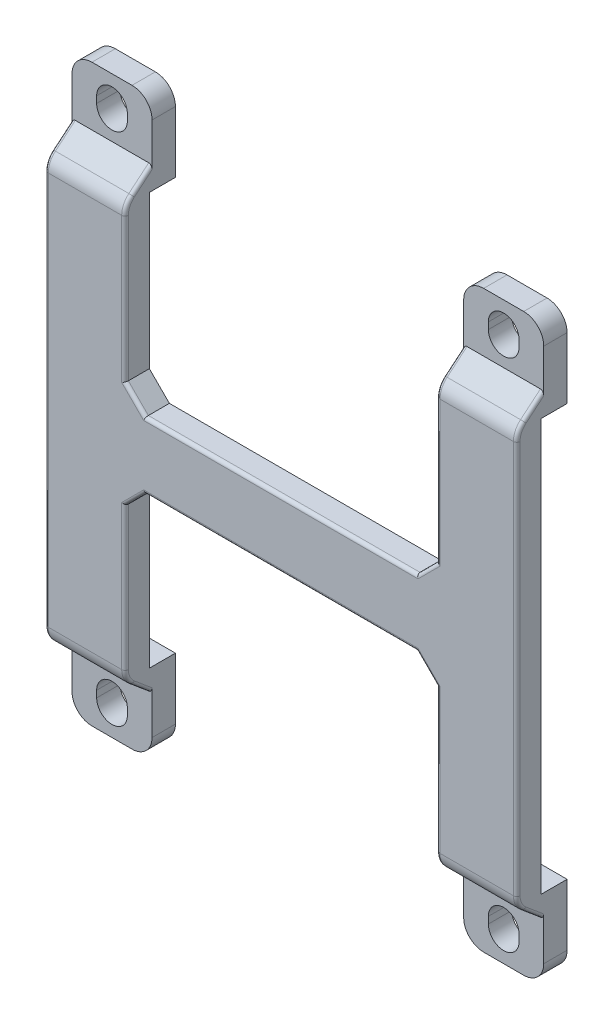
from build123d import *

# Parameters (mm, degrees)
BOSS_EXTRUDE1_DEPTH      = 3
BOSS_EXTRUDE1_DEPTH_BACK = 4.55
CUT_EXTRUDE1_DEPTH       = 3.9
CUT_EXTRUDE2_DEPTH       = 87.014737759
CHAMFER1_SIZE            = 3
FILLET1_R                = 3
FILLET2_R                = 3
FILLET3_R                = 0.5


with BuildPart() as part:
    # Sketch1 → Boss-Extrude1 (new, two sides: drawn at the far end of the back side and taken through both)
    with BuildSketch(Plane.XY.offset(-BOSS_EXTRUDE1_DEPTH_BACK)):
        Polygon((-32.872559152, 37.371494367), (-44.872559152, 37.371494367), (-44.872559152, -48.778505633), (-32.872559152, -48.778505633), (-32.872559152, -10.703505633), (13.827440848, -10.703505633), (13.827440848, -48.778505633), (25.827440848, -48.778505633), (25.827440848, 37.371494367), (13.827440848, 37.371494367), (13.827440848, -0.703505633), (-32.872559152, -0.703505633), align=None)
        with BuildLine():
            ThreePointArc((-36.572559152, 32.371494367), (-38.872559152, 30.071494367), (-41.172559152, 32.371494367))
            Line((-41.172559152, 32.371494367), (-41.172559152, 33.371494367))
            ThreePointArc((-41.172559152, 33.371494367), (-38.872559152, 35.671494367), (-36.572559152, 33.371494367))
            Line((-36.572559152, 33.371494367), (-36.572559152, 32.371494367))
        make_face(mode=Mode.SUBTRACT)
        with BuildLine():
            Line((-36.572559152, -43.778505633), (-36.572559152, -44.778505633))
            ThreePointArc((-36.572559152, -44.778505633), (-38.872559152, -47.078505633), (-41.172559152, -44.778505633))
            Line((-41.172559152, -44.778505633), (-41.172559152, -43.778505633))
            ThreePointArc((-41.172559152, -43.778505633), (-38.872559152, -41.478505633), (-36.572559152, -43.778505633))
        make_face(mode=Mode.SUBTRACT)
        with BuildLine():
            Line((17.527440848, 32.371494367), (17.527440848, 33.371494367))
            ThreePointArc((17.527440848, 33.371494367), (19.827440848, 35.671494367), (22.127440848, 33.371494367))
            Line((22.127440848, 33.371494367), (22.127440848, 32.371494367))
            ThreePointArc((22.127440848, 32.371494367), (19.827440848, 30.071494367), (17.527440848, 32.371494367))
        make_face(mode=Mode.SUBTRACT)
        with BuildLine():
            Line((22.127440848, -43.778505633), (22.127440848, -44.778505633))
            ThreePointArc((22.127440848, -44.778505633), (19.827440848, -47.078505633), (17.527440848, -44.778505633))
            Line((17.527440848, -44.778505633), (17.527440848, -43.778505633))
            ThreePointArc((17.527440848, -43.778505633), (19.827440848, -41.478505633), (22.127440848, -43.778505633))
        make_face(mode=Mode.SUBTRACT)
    extrude(amount=BOSS_EXTRUDE1_DEPTH + BOSS_EXTRUDE1_DEPTH_BACK)

    # Sketch5 → Cut-Extrude1 (cut)
    with BuildSketch(Plane(origin=(0, 0, -4.55), x_dir=(-1, 0, 0), z_dir=(0, 0, -1))):
        Polygon((-13.827440848, 25.171494367), (-25.827440848, 25.171494367), (-25.827440848, -36.569505633), (-13.827440848, -36.569505633), (-13.827440848, -10.703505633), (32.872559152, -10.703505633), (32.872559152, -36.569505633), (44.872559152, -36.569505633), (44.872559152, 25.171494367), (32.872559152, 25.171494367), (32.872559152, -0.703505633), (-13.827440848, -0.703505633), align=None)
    extrude(amount=-CUT_EXTRUDE1_DEPTH, mode=Mode.SUBTRACT)

    # Sketch6 → Cut-Extrude2 (cut, through all)
    with BuildSketch(Plane.ZY.offset(44.872559152)):
        Polygon((-1.05, 28.569847873), (3, 25.171494367), (3, 37.371494367), (-1.05, 37.371494367), align=None)
        Polygon((3, -48.778505633), (3, -36.578505633), (-1.05, -39.976859139), (-1.05, -48.778505633), align=None)
    extrude(amount=-CUT_EXTRUDE2_DEPTH, mode=Mode.SUBTRACT)

    # Chamfer1
    chamfer1_edges = [part.edges().sort_by_distance(p)[0] for p in [
        (-32.872559152, -10.703505633, 1.175),
        (-32.872559152, -0.703505633, 1.175),
        (13.827440848, -10.703505633, 1.175),
        (13.827440848, -0.703505633, 1.175),
    ]]
    chamfer(chamfer1_edges, length=CHAMFER1_SIZE)

    # Fillet1
    fillet1_edges = [part.edges().sort_by_distance(p)[0] for p in [
        (25.827440848, -48.778505633, -2.8),
        (13.827440848, -48.778505633, -2.8),
        (-32.872559152, -48.778505633, -2.8),
        (-44.872559152, -48.778505633, -2.8),
        (25.827440848, 37.371494367, -2.8),
        (13.827440848, 37.371494367, -2.8),
        (-32.872559152, 37.371494367, -2.8),
        (-44.872559152, 37.371494367, -2.8),
    ]]
    fillet(fillet1_edges, radius=FILLET1_R)

    # Fillet2
    fillet2_edges = [part.edges().sort_by_distance(p)[0] for p in [
        (19.827440848, -36.578505633, 3),
        (-38.872559152, -36.578505633, 3),
        (19.827440848, 25.171494367, 3),
        (-38.872559152, 25.171494367, 3),
    ]]
    fillet(fillet2_edges, radius=FILLET2_R)

    # Fillet3
    fillet3_edges = [part.edges().sort_by_distance(p)[0] for p in [
        (-32.872559152, -38.727287564, 0.439181415),
        (-32.872559152, -36.447437444, 2.718923361),
        (-44.872559152, 27.320276297, 0.439181415),
        (-44.872559152, 25.040426178, 2.718923361),
        (-44.872559152, -38.727287564, 0.439181415),
        (-44.872559152, -36.447437444, 2.718923361),
        (-32.872559152, 27.320276297, 0.439181415),
        (-32.872559152, 25.040426178, 2.718923361),
        (13.827440848, 27.320276297, 0.439181415),
        (13.827440848, 25.040426178, 2.718923361),
        (25.827440848, 27.320276297, 0.439181415),
        (25.827440848, 25.040426178, 2.718923361),
        (25.827440848, -38.727287564, 0.439181415),
        (25.827440848, -36.447437444, 2.718923361),
        (13.827440848, -38.727287564, 0.439181415),
        (13.827440848, -36.447437444, 2.718923361),
        (12.327440848, -12.203505633, 3),
        (-9.522559152, -10.703505633, 3),
        (-31.372559152, -12.203505633, 3),
        (-32.872559152, -24.441544146, 3),
        (-44.872559152, -5.703505633, 3),
        (-32.872559152, 13.03453288, 3),
        (-31.372559152, 0.796494367, 3),
        (-9.522559152, -0.703505633, 3),
        (12.327440848, 0.796494367, 3),
        (13.827440848, 13.03453288, 3),
        (25.827440848, -5.703505633, 3),
        (13.827440848, -24.441544146, 3),
    ]]
    fillet(fillet3_edges, radius=FILLET3_R)


solid = part.part
